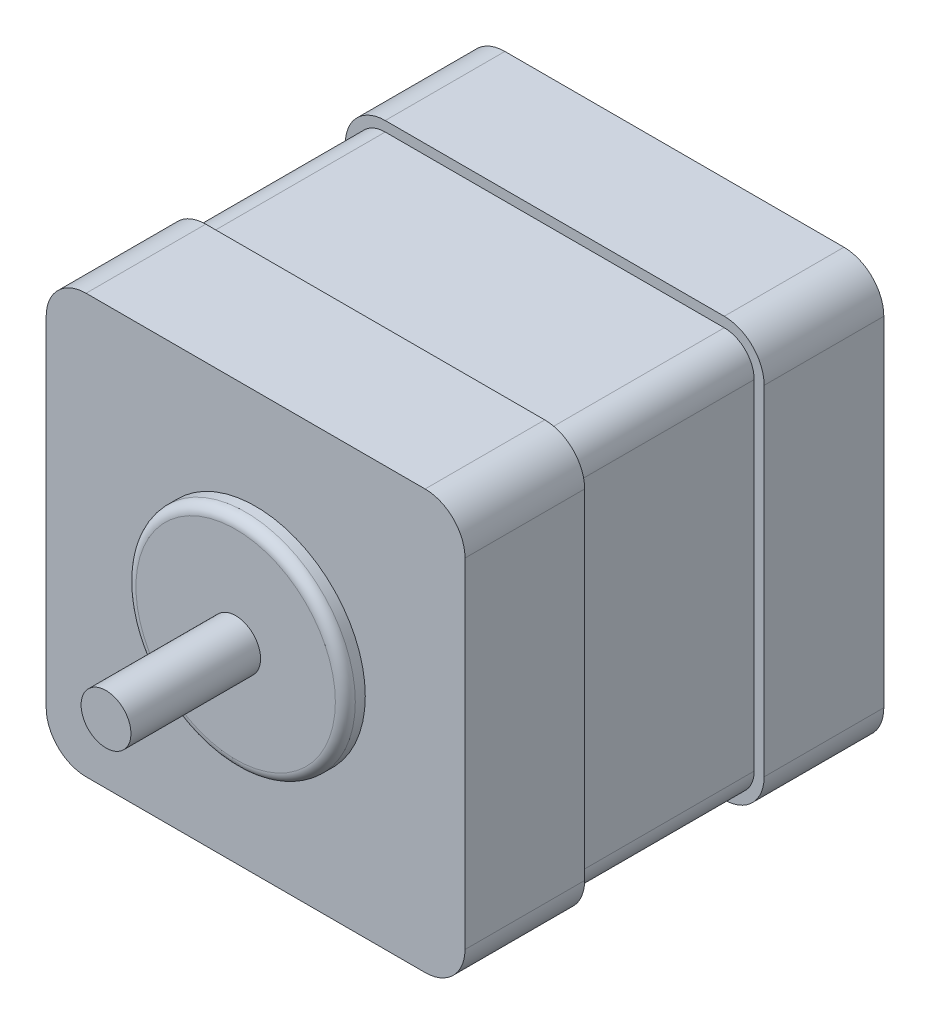
from build123d import *

# Parameters (mm, degrees)
BOSS_EXTRUDE1_DEPTH = 42
SKETCH2_R           = 11
BOSS_EXTRUDE2_DEPTH = 2
FILLET1_R           = 1
SKETCH3_R           = 2.5
BOSS_EXTRUDE3_DEPTH = 13
CUT_EXTRUDE5_START  = -6
SKETCH4_OUTSIDE_W   = 58.062
SKETCH4_OUTSIDE_H   = 58.062
SKETCH4_OUTSIDE_R   = 11
CUT_EXTRUDE5_DEPTH  = 12
BOSS_EXTRUDE4_DEPTH = 12
BOSS_EXTRUDE5_START = -12
BOSS_EXTRUDE5_DEPTH = 12


with BuildPart() as part:
    # Sketch1 → Boss-Extrude1 (new body)
    with BuildSketch(Plane.XY):
        with BuildLine():
            Line((17, -20), (-17, -20))
            ThreePointArc((-17, -20), (-19.121320344, -19.121320344), (-20, -17))
            Line((-20, -17), (-20, 17))
            ThreePointArc((-20, 17), (-19.121320344, 19.121320344), (-17, 20))
            Line((-17, 20), (17, 20))
            ThreePointArc((17, 20), (19.121320344, 19.121320344), (20, 17))
            Line((20, 17), (20, -17))
            ThreePointArc((20, -17), (19.121320344, -19.121320344), (17, -20))
        make_face()
    extrude(amount=BOSS_EXTRUDE1_DEPTH)

    # Sketch2 → Boss-Extrude2 (add)
    with BuildSketch(Plane.XY.offset(42)):
        Circle(SKETCH2_R)
    extrude(amount=BOSS_EXTRUDE2_DEPTH)

    # Fillet1
    fillet1_edges = [part.edges().sort_by_distance(p)[0] for p in [
        (-11, 0, 44),
    ]]
    fillet(fillet1_edges, radius=FILLET1_R)

    # Sketch3 → Boss-Extrude3 (add)
    with BuildSketch(Plane.XY.offset(44)):
        Circle(SKETCH3_R)
    extrude(amount=BOSS_EXTRUDE3_DEPTH)

    # Sketch4 outside → Cut-Extrude5 (cut)
    # profile 1 of 2: a face of its own
    with BuildSketch(Plane.XY.offset(42).offset(CUT_EXTRUDE5_START)):
        Rectangle(SKETCH4_OUTSIDE_W, SKETCH4_OUTSIDE_H)
        with BuildLine():
            ThreePointArc((-17, 20), (-19.121320344, 19.121320344), (-20, 17))
            Line((-20, 17), (-20, -17))
            ThreePointArc((-20, -17), (-19.121320344, -19.121320344), (-17, -20))
            Line((-17, -20), (17, -20))
            ThreePointArc((17, -20), (19.121320344, -19.121320344), (20, -17))
            Line((20, -17), (20, 17))
            ThreePointArc((20, 17), (19.121320344, 19.121320344), (17, 20))
            Line((17, 20), (-17, 20))
        make_face(mode=Mode.SUBTRACT)
    # profile 2 of 2: a face of its own
    with BuildSketch(Plane.XY.offset(42).offset(CUT_EXTRUDE5_START)):
        Circle(SKETCH4_OUTSIDE_R)
    extrude(amount=-CUT_EXTRUDE5_DEPTH, mode=Mode.SUBTRACT)

    # Sketch5 → Boss-Extrude4 (add)
    with BuildSketch(Plane.XY.offset(42)):
        with BuildLine():
            Line((-21, 17), (-21, -17))
            ThreePointArc((-21, -17), (-19.828427125, -19.828427125), (-17, -21))
            Line((-17, -21), (17, -21))
            ThreePointArc((17, -21), (19.828427125, -19.828427125), (21, -17))
            Line((21, -17), (21, 17))
            ThreePointArc((21, 17), (19.828427125, 19.828427125), (17, 21))
            Line((17, 21), (-17, 21))
            ThreePointArc((-17, 21), (-19.828427125, 19.828427125), (-21, 17))
        make_face()
    extrude(amount=-BOSS_EXTRUDE4_DEPTH)

    # Sketch6 → Boss-Extrude5 (add)
    with BuildSketch(Plane(origin=(0, 0, 0), x_dir=(-1, 0, 0), z_dir=(0, 0, -1)).offset(BOSS_EXTRUDE5_START)):
        with BuildLine():
            Line((21, -17), (21, 17))
            ThreePointArc((21, 17), (19.828427125, 19.828427125), (17, 21))
            Line((17, 21), (-17, 21))
            ThreePointArc((-17, 21), (-19.828427125, 19.828427125), (-21, 17))
            Line((-21, 17), (-21, -17))
            ThreePointArc((-21, -17), (-19.828427125, -19.828427125), (-17, -21))
            Line((-17, -21), (17, -21))
            ThreePointArc((17, -21), (19.828427125, -19.828427125), (21, -17))
        make_face()
    extrude(amount=BOSS_EXTRUDE5_DEPTH)


solid = part.part
